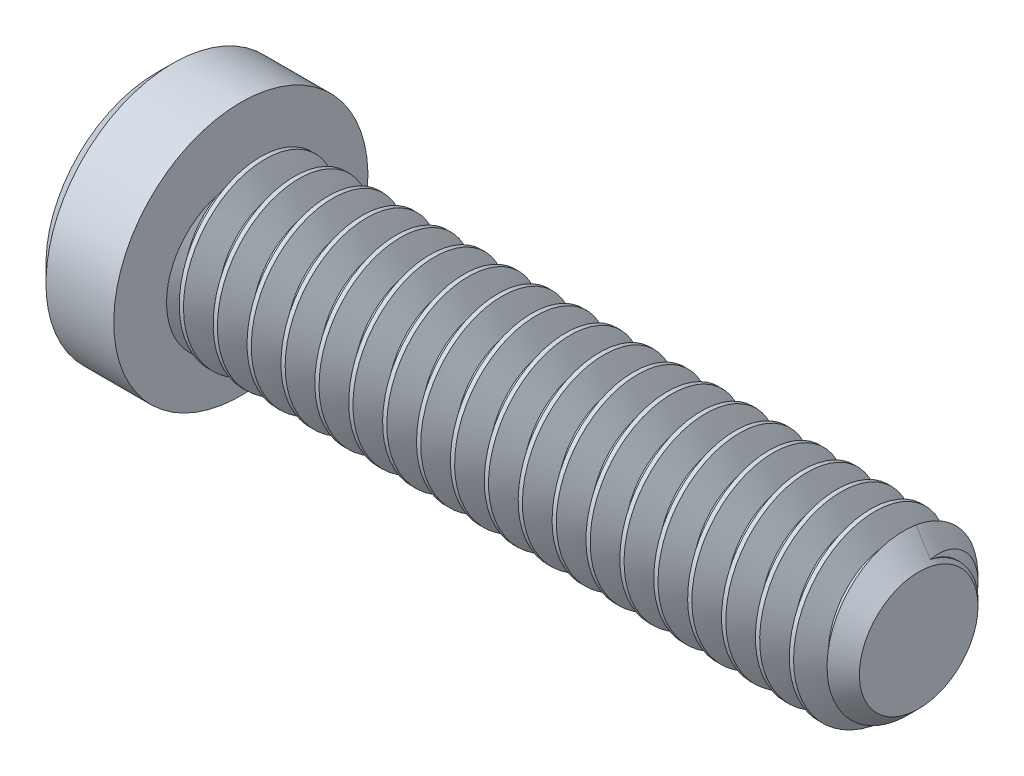
from build123d import *

# Parameters (mm, degrees)
SKETCH2_R           = 3.175
BOSS_EXTRUDE1_DEPTH = 25.4
CHAMFER1_SIZE       = 0.9525
CUT_SWEEP1_PITCH    = 1.27
CUT_EXTRUDE1_DEPTH  = 2.3876


with BuildPart() as part:
    # Sketch2 → Boss-Extrude1 (new body)
    with BuildSketch(Plane(origin=(12.7, 0, 0), x_dir=(0, 0, -1), z_dir=(1, 0, 0))):
        Circle(SKETCH2_R)
    extrude(amount=-BOSS_EXTRUDE1_DEPTH)

    # Chamfer1
    chamfer1_edges = [part.edges().sort_by_distance(p)[0] for p in [
        (12.7, 0, 3.175),
    ]]
    chamfer(chamfer1_edges, length=CHAMFER1_SIZE)

    # Cut-Sweep1: the profile of Sketch5 profile screwed along a right-hand helix of 21 turns, 8 arcs to a turn; built about Z, then put on its axis
    cut_sweep1_z = Axis((0, 0, 0), (0, 0, 1))
    cut_sweep1_corners = [(3.1753, 0, 0.555798205), (3.1753, 0, -0.555798205), (2.350110803, 0, -0.079375), (2.350110803, 0, 0.079375)]
    with BuildLine(mode=Mode.PRIVATE) as cut_sweep1_profile:
        Line(cut_sweep1_corners[0], cut_sweep1_corners[1])
        Line(cut_sweep1_corners[1], cut_sweep1_corners[2])
        Line(cut_sweep1_corners[2], cut_sweep1_corners[3])
        Line(cut_sweep1_corners[3], cut_sweep1_corners[0])
    cut_sweep1_cap = Face(cut_sweep1_profile.wire())
    cut_sweep1_turn_angles = [0, 22.5, 45, 67.5, 90, 112.5, 135, 157.5, 180, 202.5, 225, 247.5, 270, 292.5, 315, 337.5, 360]
    cut_sweep1_turn_weights = [1, 0.9238795325112867, 1, 0.9238795325112867, 1, 0.9238795325112867, 1, 0.9238795325112867, 1, 0.9238795325112867, 1, 0.9238795325112867, 1, 0.9238795325112867, 1, 0.9238795325112867, 1]
    cut_sweep1_turn_rails = [Edge.make_bspline([Vector(p[0], p[1], 0).rotate(cut_sweep1_z, cut_sweep1_turn_angles[k]) / cut_sweep1_turn_weights[k] + Vector(0, 0, p[2] + CUT_SWEEP1_PITCH * cut_sweep1_turn_angles[k] / 360) for k in range(17)], [0, 0, 0, 1, 1, 2, 2, 3, 3, 4, 4, 5, 5, 6, 6, 7, 7, 8, 8, 8], 2, cut_sweep1_turn_weights) for p in cut_sweep1_corners]
    cut_sweep1_turn_sides = [Face.make_surface_from_curves(cut_sweep1_turn_rails[p[0]], cut_sweep1_turn_rails[p[1]]) for p in [(0, 1), (1, 2), (2, 3), (3, 0)]]
    cut_sweep1 = Plane(origin=(12.7, 0, 0), x_dir=(0, 1, 0), z_dir=(-1, 0, 0)) * Solid(Shell([*[p.moved(Location((0, 0, CUT_SWEEP1_PITCH * i))) for i in range(21) for p in cut_sweep1_turn_sides], cut_sweep1_cap, cut_sweep1_cap.rotate(cut_sweep1_z, 7560).moved(Location((0, 0, CUT_SWEEP1_PITCH * 7560 / 360)))]))
    add(cut_sweep1, mode=Mode.SUBTRACT)

    # Sketch6 → Revolve1 (revolve)
    with BuildSketch(Plane.XY, mode=Mode.PRIVATE) as revolve1_sk:
        Polygon((-15.24, 4.7625), (-15.875, 4.1275), (-15.875, 0), (-12.7, 0), (-12.7, 4.7625), align=None)
    revolve(revolve1_sk.sketch.rotate(Axis((-12.7, 0, 0), (-1, 0, 0)), 13.865622854), axis=Axis((-12.7, 0, 0), (-1, 0, 0)))

    # Sketch4 → Cut-Extrude1 (cut)
    with BuildSketch(Plane(origin=(-15.875, 0, 0), x_dir=(0, 0, -1), z_dir=(1, 0, 0))):
        Polygon((0, 1.833087105), (-1.5875, 0.916543552), (-1.5875, -0.916543552), (0, -1.833087105), (1.5875, -0.916543552), (1.5875, 0.916543552), align=None)
    extrude(amount=CUT_EXTRUDE1_DEPTH, mode=Mode.SUBTRACT)

    # Cut-Extrude2 cone 1 section (through the dimple's axis) → Cut-Extrude2 (revolve, cut)
    with BuildSketch(Plane(origin=(-15.875, 0, 0), x_dir=(0, 0, 1), z_dir=(0, 1, 0))):
        Polygon((0, 0), (1.833087105, 0), (0, 1.833087105), align=None)
    revolve(axis=Axis((-15.875, 0, 0), (1, 0, 0)), mode=Mode.SUBTRACT)


solid = part.part
